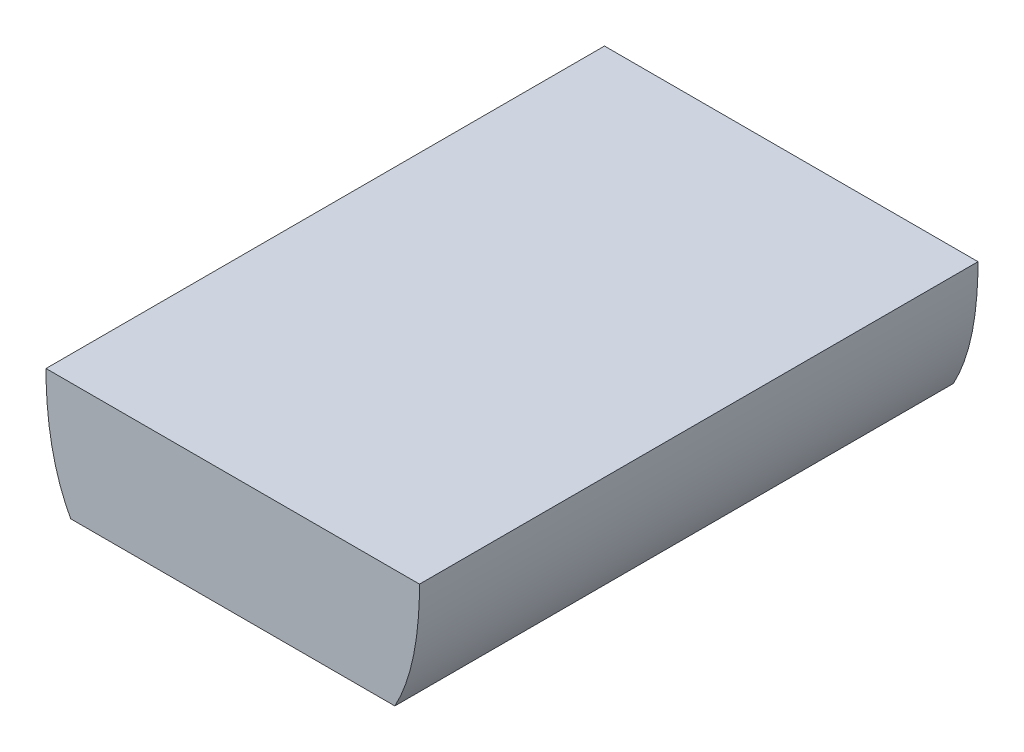
from build123d import *

# Parameters (mm, degrees)
BOSS_EXTRUDE1_DEPTH      = 452.12
BOSS_EXTRUDE1_DEPTH_BACK = 452.12
SKETCH3_W                = 604.714075682
SKETCH3_H                = 127
BOSS_EXTRUDE3_DEPTH      = 635


with BuildPart() as part:
    # Sketch1 → Boss-Extrude1 (new, two sides: drawn at the far end of the back side and taken through both)
    with BuildSketch(Plane.XY.offset(-BOSS_EXTRUDE1_DEPTH_BACK)):
        with BuildLine():
            Line((-302.357037841, 317.813001305), (302.357037841, 317.813001305))
            add(Edge.make_bspline(
                [(0, 0), (302.357037841, -0.066445002), (302.357037841, 317.813001305)],
                knots=[0, 0, 0, 1, 1, 1], degree=2, weights=[1, 1.019369595, 1]))
            add(Edge.make_bspline(
                [(0, 0), (-302.357037841, -0.066445002), (-302.357037841, 317.813001305)],
                knots=[0, 0, 0, 1, 1, 1], degree=2, weights=[1, 1.019369595, 1]))
        make_face()
    extrude(amount=BOSS_EXTRUDE1_DEPTH + BOSS_EXTRUDE1_DEPTH_BACK)


with BuildPart() as body_2:
    # Sketch3 → Boss-Extrude3 (new, symmetric)
    with BuildSketch(Plane.XY):
        with Locations((0, 63.5)):
            Rectangle(SKETCH3_W, SKETCH3_H)
    extrude(amount=BOSS_EXTRUDE3_DEPTH, both=True)


with BuildPart() as part_1:
    add(part.part)

    # Combine2: cut body 2
    add(body_2.part, mode=Mode.SUBTRACT)


solid = part_1.part
